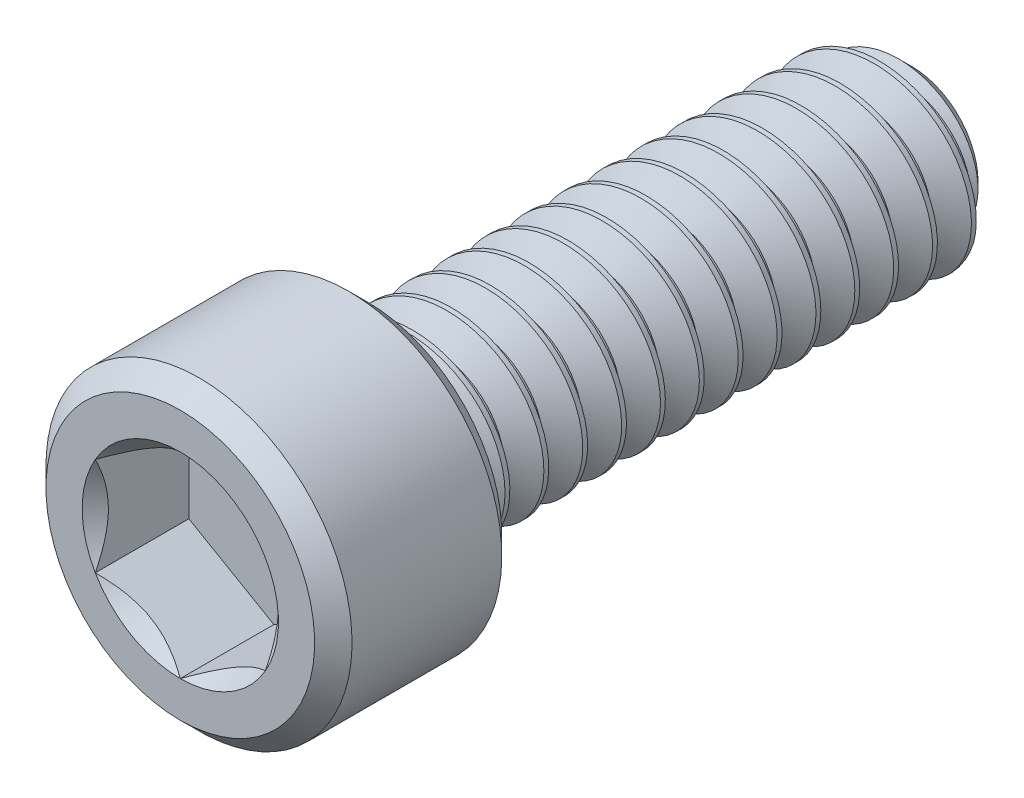
from build123d import *

# Parameters (mm, degrees)
CUT_EXTRUDE1_DEPTH = 1.0922
CUT_SWEEP1_PITCH   = 0.453571429


# Read off the part's stored shape, not the designer's step: Split1
with BuildPart() as part:
    # Sketch3 → Revolve1 (revolve)
    with BuildSketch(Plane(origin=(0, 0, 0), x_dir=(0, 0, -1), z_dir=(1, 0, 0))):
        Polygon((4.2672, 0), (-4.2672, 0), (-4.2672, 1.5674975), (-4.04876, 1.7859375), (-2.30124, 1.7859375), (-2.0828, 1.5674975), (-2.0828, 1.0922), (3.9497, 1.0922), (4.2672, 0.7747), align=None)
    revolve(axis=Axis((0, 0, -4.2672), (0, 0, 1)))

    # Sketch4 → Cut-Extrude1 (cut)
    with BuildSketch(Plane.XY.offset(4.2672)):
        Polygon((0, -1.14567944), (0.9921875, -0.57283972), (0.9921875, 0.57283972), (0, 1.14567944), (-0.9921875, 0.57283972), (-0.9921875, -0.57283972), align=None)
    extrude(amount=-CUT_EXTRUDE1_DEPTH, mode=Mode.SUBTRACT)

    # Cut-Extrude3 cone 1 section (through the dimple's axis) → Cut-Extrude3 (revolve, cut)
    with BuildSketch(Plane(origin=(0, 0, 4.2672), x_dir=(0, -1, 0), z_dir=(1, 0, 0))):
        Polygon((0, 0), (1.14567944, 0), (0, 1.14567944), align=None)
    revolve(axis=Axis((0, 0, 4.2672), (0, 0, -1)), mode=Mode.SUBTRACT)


with BuildPart() as body_2:
    # Split1: the piece on the far side of the plane
    add(part.part)
    split(bisect_by=Plane.XY.offset(2.0828), keep=Keep.BOTTOM)

    # Cut-Sweep1: the profile of Sketch7 screwed along a right-hand helix of 15 turns, 6 arcs to a turn; built about Z, then put on its axis
    cut_sweep1_z = Axis((0, 0, 0), (0, 0, 1))
    cut_sweep1_corners = [(1.116750274, 0, 0.014174107), (1.116750274, 0, -0.411049107), (0.797596715, 0, -0.226785714), (0.797596715, 0, -0.170089286)]
    with BuildLine(mode=Mode.PRIVATE) as cut_sweep1_profile:
        Line(cut_sweep1_corners[0], cut_sweep1_corners[1])
        Line(cut_sweep1_corners[1], cut_sweep1_corners[2])
        Line(cut_sweep1_corners[2], cut_sweep1_corners[3])
        Line(cut_sweep1_corners[3], cut_sweep1_corners[0])
    cut_sweep1_cap = Face(cut_sweep1_profile.wire())
    cut_sweep1_turn_angles = [0, 30, 60, 90, 120, 150, 180, 210, 240, 270, 300, 330, 360]
    cut_sweep1_turn_weights = [1, 0.8660254037844387, 1, 0.8660254037844387, 1, 0.8660254037844387, 1, 0.8660254037844387, 1, 0.8660254037844387, 1, 0.8660254037844387, 1]
    cut_sweep1_turn_rails = [Edge.make_bspline([Vector(p[0], p[1], 0).rotate(cut_sweep1_z, cut_sweep1_turn_angles[k]) / cut_sweep1_turn_weights[k] + Vector(0, 0, p[2] + CUT_SWEEP1_PITCH * cut_sweep1_turn_angles[k] / 360) for k in range(13)], [0, 0, 0, 1, 1, 2, 2, 3, 3, 4, 4, 5, 5, 6, 6, 6], 2, cut_sweep1_turn_weights) for p in cut_sweep1_corners]
    cut_sweep1_turn_sides = [Face.make_surface_from_curves(cut_sweep1_turn_rails[p[0]], cut_sweep1_turn_rails[p[1]]) for p in [(0, 1), (1, 2), (2, 3), (3, 0)]]
    cut_sweep1_turn = Solid(Shell([*cut_sweep1_turn_sides, cut_sweep1_cap, cut_sweep1_cap.rotate(cut_sweep1_z, 360).moved(Location((0, 0, CUT_SWEEP1_PITCH * 360 / 360)))]))
    cut_sweep1_each = [*[cut_sweep1_turn.moved(Location((0, 0, CUT_SWEEP1_PITCH * i))) for i in range(15)]]
    add(Plane(origin=(0, 0, -4.2672), x_dir=(0, 1, 0), z_dir=(0, 0, 1)) * Compound([cut_sweep1_each[i] for i in range(0, 15, 2)]), mode=Mode.SUBTRACT)
    add(Plane(origin=(0, 0, -4.2672), x_dir=(0, 1, 0), z_dir=(0, 0, 1)) * Compound([cut_sweep1_each[i] for i in range(1, 15, 2)]), mode=Mode.SUBTRACT)


with BuildPart() as part_1:
    add(part.part)

    # Split1
    split(bisect_by=Plane.XY.offset(2.0828), keep=Keep.TOP)

    add(body_2.part)  # Boss-Extrude1 merges body 2
    # Boss-Extrude1 cone 1 section (through the dimple's axis) → Boss-Extrude1 (revolve)
    with BuildSketch(Plane(origin=(0, 0, 2.0828), x_dir=(0, -1, 0), z_dir=(1, 0, 0))):
        Polygon((0, 0), (1.0922, 0), (0, 0.192584328), align=None)
    revolve(axis=Axis((0, 0, 2.0828), (0, 0, -1)))


solid = part_1.part
